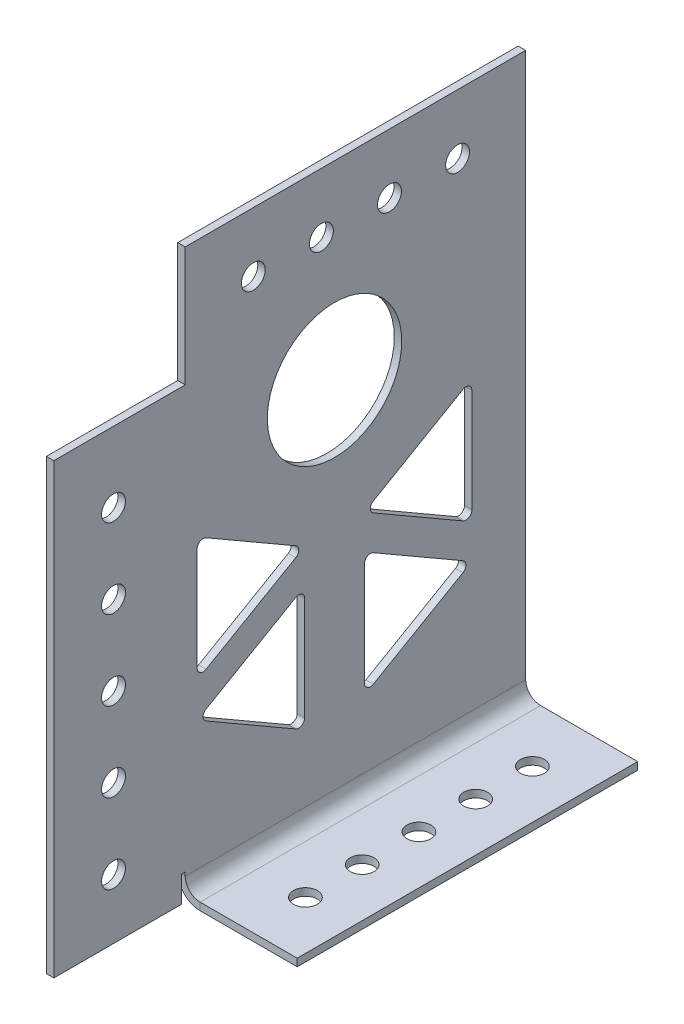
from build123d import *

# Parameters (mm, degrees)
SKETCH2_R                     = 14.2875
SKETCH2_R_2                   = 2.54
BOSS_EXTRUDE1_DEPTH           = 1.5875
SKETCH7_W                     = 1.5875
SKETCH7_H                     = 27.94
CUT_EXTRUDE1_DEPTH            = 0.00254
EDGE_FLANGE2_STRIP_W          = 12.7
EDGE_FLANGE2_STRIP_H          = 1.5875
EDGE_FLANGE2_STRIP_CUT_DEPTH  = 72.39
EDGE_FLANGE2_RELIEF_W         = 13.49375
EDGE_FLANGE2_RELIEF_H         = 0.79375
EDGE_FLANGE2_RELIEF_CUT_DEPTH = 1.5875
EDGE_FLANGE2_DEPTH            = 72.39
SKETCH14_R                    = 2.54
CUT_EXTRUDE2_DEPTH            = 2.54


# Sheet-metal steps are written as plain solids
with BuildPart() as part:
    # Sketch2 → Boss-Extrude1 (new body)
    with BuildSketch(Plane(origin=(0, 0, 0), x_dir=(0, 0, -1), z_dir=(1, 0, 0))):
        Polygon((-59.69, 95.25), (-59.69, 0), (40.64, 0), (40.64, 95.25), (40.64, 120.65), (-31.75, 120.65), (-31.75, 95.25), align=None)
        with Locations((0, 80.264)):
            Circle(SKETCH2_R, mode=Mode.SUBTRACT)
        with Locations((-46.99, 80.264)):
            Circle(SKETCH2_R_2, mode=Mode.SUBTRACT)
        with Locations((-46.99, 63.373)):
            Circle(SKETCH2_R_2, mode=Mode.SUBTRACT)
        with Locations((-17.272, 107.95)):
            Circle(SKETCH2_R_2, mode=Mode.SUBTRACT)
        with Locations((-2.794, 107.95)):
            Circle(SKETCH2_R_2, mode=Mode.SUBTRACT)
        with Locations((11.684, 107.95)):
            Circle(SKETCH2_R_2, mode=Mode.SUBTRACT)
        with Locations((26.162, 107.95)):
            Circle(SKETCH2_R_2, mode=Mode.SUBTRACT)
        with Locations((-46.99, 46.482)):
            Circle(SKETCH2_R_2, mode=Mode.SUBTRACT)
        with Locations((-46.99, 29.591)):
            Circle(SKETCH2_R_2, mode=Mode.SUBTRACT)
        with Locations((-46.99, 12.7)):
            Circle(SKETCH2_R_2, mode=Mode.SUBTRACT)
        with BuildLine():
            Line((-27.305, 64.866068321), (-8.255, 53.867545693))
            ThreePointArc((-8.255, 53.867545693), (-7.62, 52.76769343), (-8.255, 51.667841167))
            Line((-8.255, 51.667841167), (-27.305, 40.669318539))
            ThreePointArc((-27.305, 40.669318539), (-28.575, 40.669318539), (-29.21, 41.769170802))
            Line((-29.21, 41.769170802), (-29.21, 63.766216058))
            ThreePointArc((-29.21, 63.766216058), (-28.575, 64.866068321), (-27.305, 64.866068321))
        make_face(mode=Mode.SUBTRACT)
        with BuildLine():
            Line((-6.35, 43.235640486), (-6.35, 21.238595229))
            ThreePointArc((-6.35, 21.238595229), (-6.985, 20.138742967), (-8.255, 20.138742967))
            Line((-8.255, 20.138742967), (-27.305, 31.137265595))
            ThreePointArc((-27.305, 31.137265595), (-27.94, 32.237117857), (-27.305, 33.33697012))
            Line((-27.305, 33.33697012), (-8.255, 44.335492748))
            ThreePointArc((-8.255, 44.335492748), (-6.985, 44.335492748), (-6.35, 43.235640486))
        make_face(mode=Mode.SUBTRACT)
        with BuildLine():
            Line((8.255, 20.138742967), (27.305, 31.137265595))
            ThreePointArc((27.305, 31.137265595), (27.94, 32.237117857), (27.305, 33.33697012))
            Line((27.305, 33.33697012), (8.255, 44.335492748))
            ThreePointArc((8.255, 44.335492748), (6.985, 44.335492748), (6.35, 43.235640486))
            Line((6.35, 43.235640486), (6.35, 21.238595229))
            ThreePointArc((6.35, 21.238595229), (6.985, 20.138742967), (8.255, 20.138742967))
        make_face(mode=Mode.SUBTRACT)
        with BuildLine():
            Line((8.255, 51.667841167), (27.305, 40.669318539))
            ThreePointArc((27.305, 40.669318539), (28.575, 40.669318539), (29.21, 41.769170802))
            Line((29.21, 41.769170802), (29.21, 63.766216058))
            ThreePointArc((29.21, 63.766216058), (28.575, 64.866068321), (27.305, 64.866068321))
            Line((27.305, 64.866068321), (8.255, 53.867545693))
            ThreePointArc((8.255, 53.867545693), (7.62, 52.76769343), (8.255, 51.667841167))
        make_face(mode=Mode.SUBTRACT)
    extrude(amount=BOSS_EXTRUDE1_DEPTH)

    # Sketch7 → Cut-Extrude1 (cut)
    with BuildSketch(Plane(origin=(0, 0, 0), x_dir=(-1, 0, 0), z_dir=(0, -1, 0))):
        with Locations((-0.79375, -45.72)):
            Rectangle(SKETCH7_W, SKETCH7_H)
    extrude(amount=-CUT_EXTRUDE1_DEPTH, mode=Mode.SUBTRACT)

    # Edge-Flange2 strip (across the edge) → Edge-Flange2 strip cut (cut)
    with BuildSketch(Plane(origin=(1.5875, 0, 31.75), x_dir=(0, 1, 0), z_dir=(0, 0, -1))):
        with Locations((-1.5875, -0.79375)):
            Rectangle(EDGE_FLANGE2_STRIP_W, EDGE_FLANGE2_STRIP_H)
    extrude(amount=EDGE_FLANGE2_STRIP_CUT_DEPTH, mode=Mode.SUBTRACT)

    # Edge-Flange2 relief (on the sheet) → Edge-Flange2 relief cut (cut)
    with BuildSketch(Plane(origin=(1.5875, 4.7625, 31.75), x_dir=(0, 1, 0), z_dir=(1, 0, 0))):
        with Locations((-5.953125, 0.396875)):
            Rectangle(EDGE_FLANGE2_RELIEF_W, EDGE_FLANGE2_RELIEF_H)
    extrude(amount=-EDGE_FLANGE2_RELIEF_CUT_DEPTH, mode=Mode.SUBTRACT)

    # Edge-Flange2 section (across the edge) → Edge-Flange2 (add)
    with BuildSketch(Plane(origin=(1.5875, 0, 31.75), x_dir=(0, 1, 0), z_dir=(0, 0, -1))):
        with BuildLine():
            Line((0, 3.175), (0, 23.8125))
            Line((0, 23.8125), (1.5875, 23.8125))
            Line((1.5875, 23.8125), (1.5875, 3.175))
            ThreePointArc((1.5875, 3.175), (2.51743597, 0.92993597), (4.7625, 0))
            Line((4.7625, 0), (4.7625, -1.5875))
            ThreePointArc((4.7625, -1.5875), (1.394903955, -0.192596045), (0, 3.175))
        make_face()
    extrude(amount=EDGE_FLANGE2_DEPTH)

    # Sketch14 → Cut-Extrude2 (cut)
    with BuildSketch(Plane(origin=(0, 1.5875, 0), x_dir=(1, 0, 0), z_dir=(0, 1, 0))):
        with Locations(Location((15.08125, -19.685, 0), (0, 0, 180))):
            Circle(SKETCH14_R)
        with Locations(Location((15.08125, -7.62, 0), (0, 0, 180))):
            Circle(SKETCH14_R)
        with Locations(Location((15.08125, 4.445, 0), (0, 0, 180))):
            Circle(SKETCH14_R)
        with Locations(Location((15.08125, 16.51, 0), (0, 0, 180))):
            Circle(SKETCH14_R)
        with Locations(Location((15.08125, 28.575, 0), (0, 0, 180))):
            Circle(SKETCH14_R)
    extrude(amount=-CUT_EXTRUDE2_DEPTH, mode=Mode.SUBTRACT)


solid = part.part
